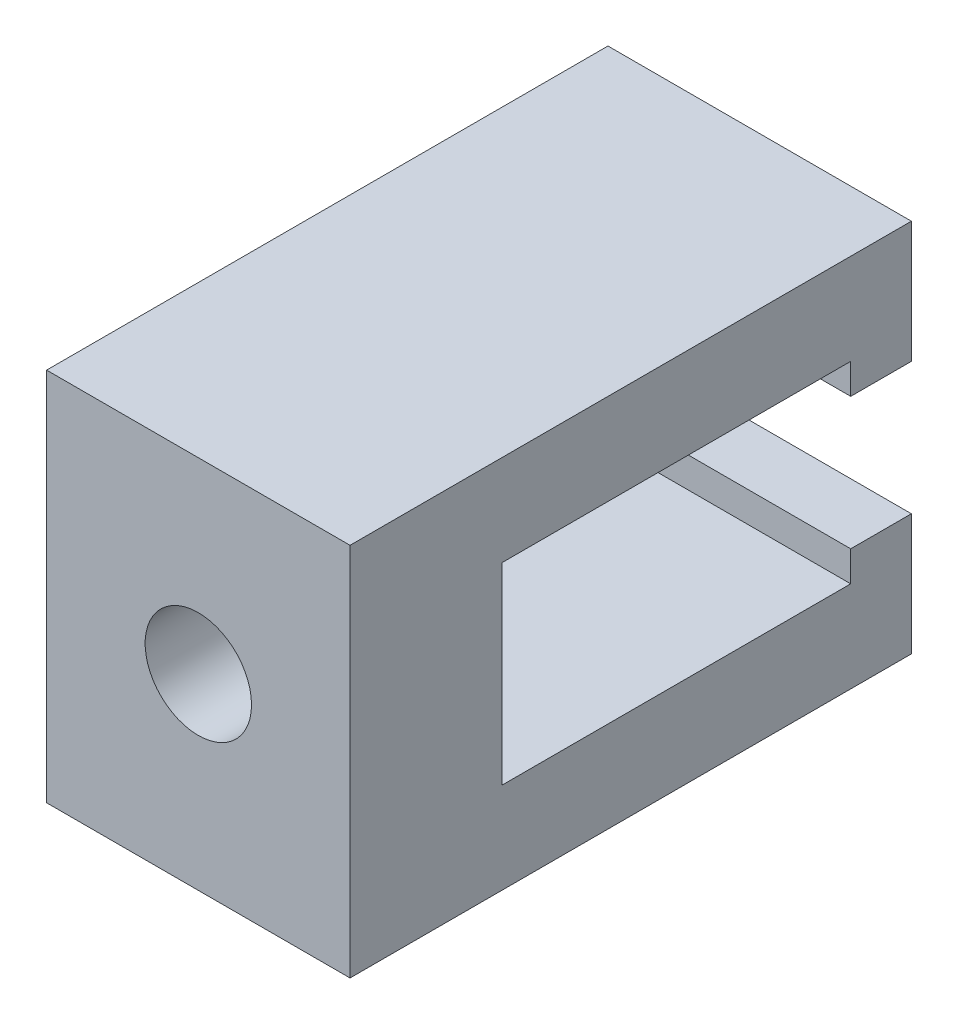
from build123d import *

# Parameters (mm, degrees)
MAINBODY_DEPTH        = 5
F_6_32_TAPPED_HOLE1_D = 3.5052


with BuildPart() as part:
    # Sketch1 → MainBody (new, symmetric)
    with BuildSketch(Plane(origin=(0, 0, 0), x_dir=(0, 0, -1), z_dir=(1, 0, 0))):
        Polygon((9.494840321, 4.836344791), (-9.005159679, 4.836344791), (-9.005159679, -7.513655209), (9.494840321, -7.513655209), (9.494840321, -3.513655209), (7.494840321, -3.513655209), (7.494840321, -4.513655209), (-4.005159679, -4.513655209), (-4.005159679, 1.836344791), (7.494840321, 1.836344791), (7.494840321, 0.836344791), (9.494840321, 0.836344791), align=None)
    extrude(amount=MAINBODY_DEPTH, both=True)

    # #6-32 Tapped Hole1 (through all)
    with Locations(Plane.XY.offset(9.005159679)):
        with Locations((0, -1.338655209)):
            Hole(F_6_32_TAPPED_HOLE1_D / 2)


solid = part.part
